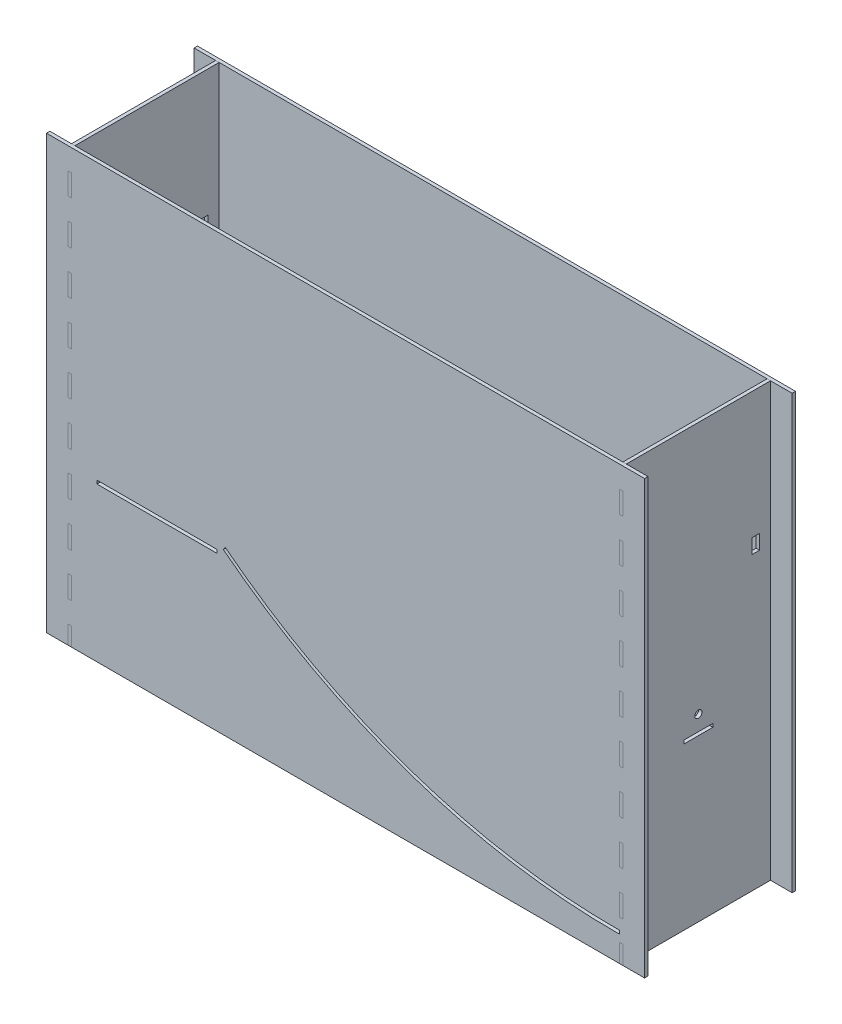
from build123d import *

# Parameters (mm, degrees)
SKETCH1_W                  = 488.5944
SKETCH1_H                  = 132.9944
SKETCH1_W_2                = 482.6
SKETCH1_H_2                = 127
BASE_EXTRUDE_DEPTH         = 2.9972
SKETCH1_3_W                = 488.5944
SKETCH1_3_H                = 132.9944
SKETCH1_3_W_2              = 482.6
SKETCH1_3_H_2              = 127
WALL_EXTRUDE_DEPTH         = 383.9972
LEDGERAMP_W                = 105.8672
LEDGERAMP_H                = 2.9972
CUT_EXTRUDE6_DEPTH         = 475.154491666
SKETCH19_R                 = 3.175
SKETCH19_W                 = 25.4
SKETCH19_H                 = 2.9972
SKETCH19_W_2               = 6.477
SKETCH19_H_2               = 12.827
SIDE_CUTS_DEPTH            = 625.980171627
SKETCH23_W                 = 19.05
SKETCH23_H                 = 383.9972
BOSS_EXTRUDE1_DEPTH        = 2.9972
BOSS_EXTRUDE2_START        = -132.9944
SKETCH23_2_W               = 19.05
SKETCH23_2_H               = 383.9972
BOSS_EXTRUDE2_DEPTH        = 2.9972
SKETCH21_W                 = 12.827
SKETCH21_H                 = 6.477
SKETCH21_W_2               = 6.477
SKETCH21_H_2               = 12.827
SKETCH21_W_3               = 3.175
BOTTOM_SUPPORT_HOLES_DEPTH = 471.348248603
SPLIT1_START               = -244.2972
SPLIT1_OUTLINE_W           = 12.827
SPLIT1_OUTLINE_H           = 6.477
SPLIT1_OUTLINE_W_2         = 2.9972
SPLIT1_OUTLINE_H_2         = 25.4
SPLIT1_OUTLINE_R           = 3.175
SPLIT1_DEPTH               = 2.9972
SPLIT1_START_2             = 2.9972
SPLIT1_2_OUTLINE_W         = 2.9972
SPLIT1_2_OUTLINE_H         = 127
SPLIT1_2_DEPTH             = 381
SPLIT1_3_OUTLINE_W         = 2.9972
SPLIT1_3_OUTLINE_H         = 12.0904
SPLIT1_3_DEPTH             = 19.19986
SPLIT1_START_3             = 38.39972
SPLIT1_4_OUTLINE_W         = 2.9972
SPLIT1_4_OUTLINE_H         = 2.9972
SPLIT1_4_DEPTH             = 19.19986
SPLIT1_START_4             = 76.79944
SPLIT1_5_OUTLINE_W         = 2.9972
SPLIT1_5_OUTLINE_H         = 2.9972
SPLIT1_5_DEPTH             = 19.19986
SPLIT1_START_5             = 115.19916
SPLIT1_6_OUTLINE_W         = 2.9972
SPLIT1_6_OUTLINE_H         = 2.9972
SPLIT1_6_DEPTH             = 19.19986
SPLIT1_START_6             = 153.59888
SPLIT1_7_OUTLINE_W         = 2.9972
SPLIT1_7_OUTLINE_H         = 2.9972
SPLIT1_7_DEPTH             = 19.19986
SPLIT1_START_7             = 191.9986
SPLIT1_8_OUTLINE_W         = 2.9972
SPLIT1_8_OUTLINE_H         = 2.9972
SPLIT1_8_DEPTH             = 19.19986
SPLIT1_START_8             = 230.39832
SPLIT1_9_OUTLINE_W         = 2.9972
SPLIT1_9_OUTLINE_H         = 2.9972
SPLIT1_9_DEPTH             = 19.19986
SPLIT1_START_9             = 268.79804
SPLIT1_10_OUTLINE_W        = 2.9972
SPLIT1_10_OUTLINE_H        = 2.9972
SPLIT1_10_DEPTH            = 19.19986
SPLIT1_START_10            = 307.19776
SPLIT1_11_OUTLINE_W        = 2.9972
SPLIT1_11_OUTLINE_H        = 2.9972
SPLIT1_11_DEPTH            = 19.19986
SPLIT1_START_11            = 345.59748
SPLIT1_12_OUTLINE_W        = 2.9972
SPLIT1_12_OUTLINE_H        = 2.9972
SPLIT1_12_DEPTH            = 19.19986
SPLIT2_START               = 241.3
SPLIT2_OUTLINE_W           = 12.827
SPLIT2_OUTLINE_H           = 6.477
SPLIT2_OUTLINE_W_2         = 2.9972
SPLIT2_OUTLINE_H_2         = 25.4
SPLIT2_OUTLINE_R           = 3.175
SPLIT2_DEPTH               = 2.9972
SPLIT2_START_2             = 2.9972
SPLIT2_2_OUTLINE_W         = 2.9972
SPLIT2_2_OUTLINE_H         = 127
SPLIT2_2_DEPTH             = 381
SPLIT2_3_OUTLINE_W         = 2.9972
SPLIT2_3_OUTLINE_H         = 12.0904
SPLIT2_3_DEPTH             = 19.19986
SPLIT2_START_3             = 38.39972
SPLIT2_4_OUTLINE_W         = 2.9972
SPLIT2_4_OUTLINE_H         = 2.9972
SPLIT2_4_DEPTH             = 19.19986
SPLIT2_START_4             = 76.79944
SPLIT2_5_OUTLINE_W         = 2.9972
SPLIT2_5_OUTLINE_H         = 2.9972
SPLIT2_5_DEPTH             = 19.19986
SPLIT2_START_5             = 115.19916
SPLIT2_6_OUTLINE_W         = 2.9972
SPLIT2_6_OUTLINE_H         = 2.9972
SPLIT2_6_DEPTH             = 19.19986
SPLIT2_START_6             = 153.59888
SPLIT2_7_OUTLINE_W         = 2.9972
SPLIT2_7_OUTLINE_H         = 2.9972
SPLIT2_7_DEPTH             = 19.19986
SPLIT2_START_7             = 191.9986
SPLIT2_8_OUTLINE_W         = 2.9972
SPLIT2_8_OUTLINE_H         = 2.9972
SPLIT2_8_DEPTH             = 19.19986
SPLIT2_START_8             = 230.39832
SPLIT2_9_OUTLINE_W         = 2.9972
SPLIT2_9_OUTLINE_H         = 2.9972
SPLIT2_9_DEPTH             = 19.19986
SPLIT2_START_9             = 268.79804
SPLIT2_10_OUTLINE_W        = 2.9972
SPLIT2_10_OUTLINE_H        = 2.9972
SPLIT2_10_DEPTH            = 19.19986
SPLIT2_START_10            = 307.19776
SPLIT2_11_OUTLINE_W        = 2.9972
SPLIT2_11_OUTLINE_H        = 2.9972
SPLIT2_11_DEPTH            = 19.19986
SPLIT2_START_11            = 345.59748
SPLIT2_12_OUTLINE_W        = 2.9972
SPLIT2_12_OUTLINE_H        = 2.9972
SPLIT2_12_DEPTH            = 19.19986
SKETCH22_W                 = 526.6944
SKETCH22_H                 = 2.9972
CUT_EXTRUDE5_DEPTH         = 485.24488411


# Read off the part's stored shape, not the designer's step: Split1, Split2
with BuildPart() as part:
    # Sketch1 → Base Extrude (new body)
    # profile 1 of 2: a face of its own
    with BuildSketch(Plane(origin=(0, 0, 0), x_dir=(1, 0, 0), z_dir=(0, 1, 0))):
        Rectangle(SKETCH1_W, SKETCH1_H)
        Rectangle(SKETCH1_W_2, SKETCH1_H_2, mode=Mode.SUBTRACT)
    # profile 2 of 2: a face of its own
    with BuildSketch(Plane(origin=(0, 0, 0), x_dir=(1, 0, 0), z_dir=(0, 1, 0))):
        Rectangle(SKETCH1_W_2, SKETCH1_H_2)
    extrude(amount=BASE_EXTRUDE_DEPTH)

    # Sketch1<3> → Wall Extrude (add)
    with BuildSketch(Plane(origin=(0, 0, 0), x_dir=(1, 0, 0), z_dir=(0, 1, 0))):
        Rectangle(SKETCH1_3_W, SKETCH1_3_H)
        Rectangle(SKETCH1_3_W_2, SKETCH1_3_H_2, mode=Mode.SUBTRACT)
    extrude(amount=WALL_EXTRUDE_DEPTH)

    # LedgeRamp → Cut-Extrude6 (cut, through all)
    with BuildSketch(Plane.XY.offset(66.4972)):
        with Locations((-165.9636, 140.125825062)):
            Rectangle(LEDGERAMP_W, LEDGERAMP_H)
        with BuildLine():
            Line((-107.653518998, 144.347145989), (-105.808258425, 146.70897182))
            ThreePointArc((-105.808258425, 146.70897182), (57.751905861, 58.232368422), (241.3, 28.397257769))
            Line((241.3, 28.397257769), (241.3, 25.4))
            ThreePointArc((241.3, 25.4), (56.776108201, 55.39844652), (-107.653518998, 144.347145989))
        make_face()
    extrude(amount=-CUT_EXTRUDE6_DEPTH, mode=Mode.SUBTRACT)

    # Sketch19 → Side Cuts (cut, through all)
    with BuildSketch(Plane.ZY.offset(244.2972)):
        with Locations((0, 161.511017861)):
            Circle(SKETCH19_R)
        with Locations((0, 146.550417861)):
            Rectangle(SKETCH19_W, SKETCH19_H)
        with Locations((-50.5587, 266.02310893)):
            Rectangle(SKETCH19_W_2, SKETCH19_H_2)
        with Locations((50.5587, 266.02310893)):
            Rectangle(SKETCH19_W_2, SKETCH19_H_2)
    extrude(amount=-SIDE_CUTS_DEPTH, mode=Mode.SUBTRACT)

    # Sketch23 → Boss-Extrude1 (add)
    with BuildSketch(Plane.XY.offset(66.4972)):
        with Locations((-253.8222, 191.9986)):
            Rectangle(SKETCH23_W, SKETCH23_H)
        with Locations((253.8222, 191.9986)):
            Rectangle(SKETCH23_W, SKETCH23_H)
    extrude(amount=-BOSS_EXTRUDE1_DEPTH)

    # Sketch23<2> → Boss-Extrude2 (add)
    with BuildSketch(Plane.XY.offset(66.4972).offset(BOSS_EXTRUDE2_START)):
        with Locations((-253.8222, 191.9986)):
            Rectangle(SKETCH23_2_W, SKETCH23_2_H)
        with Locations((253.8222, 191.9986)):
            Rectangle(SKETCH23_2_W, SKETCH23_2_H)
    extrude(amount=BOSS_EXTRUDE2_DEPTH)

    # Sketch21 → Bottom Support Holes (cut, through all)
    with BuildSketch(Plane.XZ):
        with Locations((0, 50.5587)):
            Rectangle(SKETCH21_W, SKETCH21_H)
        with Locations((-228.3587, 0)):
            Rectangle(SKETCH21_W_2, SKETCH21_H_2)
        with Locations((0, -50.5587)):
            Rectangle(SKETCH21_W, SKETCH21_H)
        with Locations((230.0097, 0)):
            Rectangle(SKETCH21_W_3, SKETCH21_H_2)
    extrude(amount=-BOTTOM_SUPPORT_HOLES_DEPTH, mode=Mode.SUBTRACT)

    # Split1 2 outline → Split1 2 (cut)
    with BuildSketch(Plane(origin=(0, 0, 0), x_dir=(1, 0, 0), z_dir=(0, 1, 0)).offset(SPLIT1_START_2)):
        with Locations((-242.7986, 0)):
            Rectangle(SPLIT1_2_OUTLINE_W, SPLIT1_2_OUTLINE_H)
    extrude(amount=SPLIT1_2_DEPTH, mode=Mode.SUBTRACT)

    # Split1 3 outline → Split1 3 (cut)
    with BuildSketch(Plane(origin=(0, 0, 0), x_dir=(1, 0, 0), z_dir=(0, 1, 0))):
        with Locations((-242.7986, 60.452)):
            Rectangle(SPLIT1_3_OUTLINE_W, SPLIT1_3_OUTLINE_H)
        with Locations((-242.7986, 36.2712)):
            Rectangle(SPLIT1_3_OUTLINE_W, SPLIT1_3_OUTLINE_H)
        with Locations((-242.7986, 12.0904)):
            Rectangle(SPLIT1_3_OUTLINE_W, SPLIT1_3_OUTLINE_H)
        with Locations((-242.7986, -12.0904)):
            Rectangle(SPLIT1_3_OUTLINE_W, SPLIT1_3_OUTLINE_H)
        with Locations((-242.7986, -36.2712)):
            Rectangle(SPLIT1_3_OUTLINE_W, SPLIT1_3_OUTLINE_H)
        with Locations((-242.7986, -60.452)):
            Rectangle(SPLIT1_3_OUTLINE_W, SPLIT1_3_OUTLINE_H)
    extrude(amount=SPLIT1_3_DEPTH, mode=Mode.SUBTRACT)

    # Split1 4 outline → Split1 4 (cut)
    with BuildSketch(Plane(origin=(0, 0, 0), x_dir=(1, 0, 0), z_dir=(0, 1, 0)).offset(SPLIT1_START_3)):
        with Locations((-242.7986, 64.9986)):
            Rectangle(SPLIT1_4_OUTLINE_W, SPLIT1_4_OUTLINE_H)
        with Locations((-242.7986, -64.9986)):
            Rectangle(SPLIT1_4_OUTLINE_W, SPLIT1_4_OUTLINE_H)
    extrude(amount=SPLIT1_4_DEPTH, mode=Mode.SUBTRACT)

    # Split1 5 outline → Split1 5 (cut)
    with BuildSketch(Plane(origin=(0, 0, 0), x_dir=(1, 0, 0), z_dir=(0, 1, 0)).offset(SPLIT1_START_4)):
        with Locations((-242.7986, 64.9986)):
            Rectangle(SPLIT1_5_OUTLINE_W, SPLIT1_5_OUTLINE_H)
        with Locations((-242.7986, -64.9986)):
            Rectangle(SPLIT1_5_OUTLINE_W, SPLIT1_5_OUTLINE_H)
    extrude(amount=SPLIT1_5_DEPTH, mode=Mode.SUBTRACT)

    # Split1 6 outline → Split1 6 (cut)
    with BuildSketch(Plane(origin=(0, 0, 0), x_dir=(1, 0, 0), z_dir=(0, 1, 0)).offset(SPLIT1_START_5)):
        with Locations((-242.7986, 64.9986)):
            Rectangle(SPLIT1_6_OUTLINE_W, SPLIT1_6_OUTLINE_H)
        with Locations((-242.7986, -64.9986)):
            Rectangle(SPLIT1_6_OUTLINE_W, SPLIT1_6_OUTLINE_H)
    extrude(amount=SPLIT1_6_DEPTH, mode=Mode.SUBTRACT)

    # Split1 7 outline → Split1 7 (cut)
    with BuildSketch(Plane(origin=(0, 0, 0), x_dir=(1, 0, 0), z_dir=(0, 1, 0)).offset(SPLIT1_START_6)):
        with Locations((-242.7986, 64.9986)):
            Rectangle(SPLIT1_7_OUTLINE_W, SPLIT1_7_OUTLINE_H)
        with Locations((-242.7986, -64.9986)):
            Rectangle(SPLIT1_7_OUTLINE_W, SPLIT1_7_OUTLINE_H)
    extrude(amount=SPLIT1_7_DEPTH, mode=Mode.SUBTRACT)

    # Split1 8 outline → Split1 8 (cut)
    with BuildSketch(Plane(origin=(0, 0, 0), x_dir=(1, 0, 0), z_dir=(0, 1, 0)).offset(SPLIT1_START_7)):
        with Locations((-242.7986, 64.9986)):
            Rectangle(SPLIT1_8_OUTLINE_W, SPLIT1_8_OUTLINE_H)
        with Locations((-242.7986, -64.9986)):
            Rectangle(SPLIT1_8_OUTLINE_W, SPLIT1_8_OUTLINE_H)
    extrude(amount=SPLIT1_8_DEPTH, mode=Mode.SUBTRACT)

    # Split1 9 outline → Split1 9 (cut)
    with BuildSketch(Plane(origin=(0, 0, 0), x_dir=(1, 0, 0), z_dir=(0, 1, 0)).offset(SPLIT1_START_8)):
        with Locations((-242.7986, 64.9986)):
            Rectangle(SPLIT1_9_OUTLINE_W, SPLIT1_9_OUTLINE_H)
        with Locations((-242.7986, -64.9986)):
            Rectangle(SPLIT1_9_OUTLINE_W, SPLIT1_9_OUTLINE_H)
    extrude(amount=SPLIT1_9_DEPTH, mode=Mode.SUBTRACT)

    # Split1 10 outline → Split1 10 (cut)
    with BuildSketch(Plane(origin=(0, 0, 0), x_dir=(1, 0, 0), z_dir=(0, 1, 0)).offset(SPLIT1_START_9)):
        with Locations((-242.7986, 64.9986)):
            Rectangle(SPLIT1_10_OUTLINE_W, SPLIT1_10_OUTLINE_H)
        with Locations((-242.7986, -64.9986)):
            Rectangle(SPLIT1_10_OUTLINE_W, SPLIT1_10_OUTLINE_H)
    extrude(amount=SPLIT1_10_DEPTH, mode=Mode.SUBTRACT)

    # Split1 11 outline → Split1 11 (cut)
    with BuildSketch(Plane(origin=(0, 0, 0), x_dir=(1, 0, 0), z_dir=(0, 1, 0)).offset(SPLIT1_START_10)):
        with Locations((-242.7986, 64.9986)):
            Rectangle(SPLIT1_11_OUTLINE_W, SPLIT1_11_OUTLINE_H)
        with Locations((-242.7986, -64.9986)):
            Rectangle(SPLIT1_11_OUTLINE_W, SPLIT1_11_OUTLINE_H)
    extrude(amount=SPLIT1_11_DEPTH, mode=Mode.SUBTRACT)

    # Split1 12 outline → Split1 12 (cut)
    with BuildSketch(Plane(origin=(0, 0, 0), x_dir=(1, 0, 0), z_dir=(0, 1, 0)).offset(SPLIT1_START_11)):
        with Locations((-242.7986, 64.9986)):
            Rectangle(SPLIT1_12_OUTLINE_W, SPLIT1_12_OUTLINE_H)
        with Locations((-242.7986, -64.9986)):
            Rectangle(SPLIT1_12_OUTLINE_W, SPLIT1_12_OUTLINE_H)
    extrude(amount=SPLIT1_12_DEPTH, mode=Mode.SUBTRACT)

    # Split2 2 outline → Split2 2 (cut)
    with BuildSketch(Plane(origin=(0, 0, 0), x_dir=(1, 0, 0), z_dir=(0, 1, 0)).offset(SPLIT2_START_2)):
        with Locations((242.7986, 0)):
            Rectangle(SPLIT2_2_OUTLINE_W, SPLIT2_2_OUTLINE_H)
    extrude(amount=SPLIT2_2_DEPTH, mode=Mode.SUBTRACT)

    # Split2 3 outline → Split2 3 (cut)
    with BuildSketch(Plane(origin=(0, 0, 0), x_dir=(1, 0, 0), z_dir=(0, 1, 0))):
        with Locations((242.7986, 60.452)):
            Rectangle(SPLIT2_3_OUTLINE_W, SPLIT2_3_OUTLINE_H)
        with Locations((242.7986, 36.2712)):
            Rectangle(SPLIT2_3_OUTLINE_W, SPLIT2_3_OUTLINE_H)
        with Locations((242.7986, 12.0904)):
            Rectangle(SPLIT2_3_OUTLINE_W, SPLIT2_3_OUTLINE_H)
        with Locations((242.7986, -12.0904)):
            Rectangle(SPLIT2_3_OUTLINE_W, SPLIT2_3_OUTLINE_H)
        with Locations((242.7986, -36.2712)):
            Rectangle(SPLIT2_3_OUTLINE_W, SPLIT2_3_OUTLINE_H)
        with Locations((242.7986, -60.452)):
            Rectangle(SPLIT2_3_OUTLINE_W, SPLIT2_3_OUTLINE_H)
    extrude(amount=SPLIT2_3_DEPTH, mode=Mode.SUBTRACT)

    # Split2 4 outline → Split2 4 (cut)
    with BuildSketch(Plane(origin=(0, 0, 0), x_dir=(1, 0, 0), z_dir=(0, 1, 0)).offset(SPLIT2_START_3)):
        with Locations((242.7986, 64.9986)):
            Rectangle(SPLIT2_4_OUTLINE_W, SPLIT2_4_OUTLINE_H)
        with Locations((242.7986, -64.9986)):
            Rectangle(SPLIT2_4_OUTLINE_W, SPLIT2_4_OUTLINE_H)
    extrude(amount=SPLIT2_4_DEPTH, mode=Mode.SUBTRACT)

    # Split2 5 outline → Split2 5 (cut)
    with BuildSketch(Plane(origin=(0, 0, 0), x_dir=(1, 0, 0), z_dir=(0, 1, 0)).offset(SPLIT2_START_4)):
        with Locations((242.7986, 64.9986)):
            Rectangle(SPLIT2_5_OUTLINE_W, SPLIT2_5_OUTLINE_H)
        with Locations((242.7986, -64.9986)):
            Rectangle(SPLIT2_5_OUTLINE_W, SPLIT2_5_OUTLINE_H)
    extrude(amount=SPLIT2_5_DEPTH, mode=Mode.SUBTRACT)

    # Split2 6 outline → Split2 6 (cut)
    with BuildSketch(Plane(origin=(0, 0, 0), x_dir=(1, 0, 0), z_dir=(0, 1, 0)).offset(SPLIT2_START_5)):
        with Locations((242.7986, 64.9986)):
            Rectangle(SPLIT2_6_OUTLINE_W, SPLIT2_6_OUTLINE_H)
        with Locations((242.7986, -64.9986)):
            Rectangle(SPLIT2_6_OUTLINE_W, SPLIT2_6_OUTLINE_H)
    extrude(amount=SPLIT2_6_DEPTH, mode=Mode.SUBTRACT)

    # Split2 7 outline → Split2 7 (cut)
    with BuildSketch(Plane(origin=(0, 0, 0), x_dir=(1, 0, 0), z_dir=(0, 1, 0)).offset(SPLIT2_START_6)):
        with Locations((242.7986, 64.9986)):
            Rectangle(SPLIT2_7_OUTLINE_W, SPLIT2_7_OUTLINE_H)
        with Locations((242.7986, -64.9986)):
            Rectangle(SPLIT2_7_OUTLINE_W, SPLIT2_7_OUTLINE_H)
    extrude(amount=SPLIT2_7_DEPTH, mode=Mode.SUBTRACT)

    # Split2 8 outline → Split2 8 (cut)
    with BuildSketch(Plane(origin=(0, 0, 0), x_dir=(1, 0, 0), z_dir=(0, 1, 0)).offset(SPLIT2_START_7)):
        with Locations((242.7986, 64.9986)):
            Rectangle(SPLIT2_8_OUTLINE_W, SPLIT2_8_OUTLINE_H)
        with Locations((242.7986, -64.9986)):
            Rectangle(SPLIT2_8_OUTLINE_W, SPLIT2_8_OUTLINE_H)
    extrude(amount=SPLIT2_8_DEPTH, mode=Mode.SUBTRACT)

    # Split2 9 outline → Split2 9 (cut)
    with BuildSketch(Plane(origin=(0, 0, 0), x_dir=(1, 0, 0), z_dir=(0, 1, 0)).offset(SPLIT2_START_8)):
        with Locations((242.7986, 64.9986)):
            Rectangle(SPLIT2_9_OUTLINE_W, SPLIT2_9_OUTLINE_H)
        with Locations((242.7986, -64.9986)):
            Rectangle(SPLIT2_9_OUTLINE_W, SPLIT2_9_OUTLINE_H)
    extrude(amount=SPLIT2_9_DEPTH, mode=Mode.SUBTRACT)

    # Split2 10 outline → Split2 10 (cut)
    with BuildSketch(Plane(origin=(0, 0, 0), x_dir=(1, 0, 0), z_dir=(0, 1, 0)).offset(SPLIT2_START_9)):
        with Locations((242.7986, 64.9986)):
            Rectangle(SPLIT2_10_OUTLINE_W, SPLIT2_10_OUTLINE_H)
        with Locations((242.7986, -64.9986)):
            Rectangle(SPLIT2_10_OUTLINE_W, SPLIT2_10_OUTLINE_H)
    extrude(amount=SPLIT2_10_DEPTH, mode=Mode.SUBTRACT)

    # Split2 11 outline → Split2 11 (cut)
    with BuildSketch(Plane(origin=(0, 0, 0), x_dir=(1, 0, 0), z_dir=(0, 1, 0)).offset(SPLIT2_START_10)):
        with Locations((242.7986, 64.9986)):
            Rectangle(SPLIT2_11_OUTLINE_W, SPLIT2_11_OUTLINE_H)
        with Locations((242.7986, -64.9986)):
            Rectangle(SPLIT2_11_OUTLINE_W, SPLIT2_11_OUTLINE_H)
    extrude(amount=SPLIT2_11_DEPTH, mode=Mode.SUBTRACT)

    # Split2 12 outline → Split2 12 (cut)
    with BuildSketch(Plane(origin=(0, 0, 0), x_dir=(1, 0, 0), z_dir=(0, 1, 0)).offset(SPLIT2_START_11)):
        with Locations((242.7986, 64.9986)):
            Rectangle(SPLIT2_12_OUTLINE_W, SPLIT2_12_OUTLINE_H)
        with Locations((242.7986, -64.9986)):
            Rectangle(SPLIT2_12_OUTLINE_W, SPLIT2_12_OUTLINE_H)
    extrude(amount=SPLIT2_12_DEPTH, mode=Mode.SUBTRACT)


with BuildPart() as body_2:
    # Split1 outline → Split1 (new body)
    with BuildSketch(Plane.YZ.offset(SPLIT1_START)):
        Polygon((38.39972, 63.5), (19.19986, 63.5), (19.19986, 66.4972), (0, 66.4972), (0, 54.4068), (2.9972, 54.4068), (2.9972, 42.3164), (0, 42.3164), (0, 30.226), (2.9972, 30.226), (2.9972, 18.1356), (0, 18.1356), (0, 6.0452), (2.9972, 6.0452), (2.9972, -6.0452), (0, -6.0452), (0, -18.1356), (2.9972, -18.1356), (2.9972, -30.226), (0, -30.226), (0, -42.3164), (2.9972, -42.3164), (2.9972, -54.4068), (0, -54.4068), (0, -66.4972), (19.19986, -66.4972), (19.19986, -63.5), (38.39972, -63.5), (38.39972, -66.4972), (57.59958, -66.4972), (57.59958, -63.5), (76.79944, -63.5), (76.79944, -66.4972), (95.9993, -66.4972), (95.9993, -63.5), (115.19916, -63.5), (115.19916, -66.4972), (134.39902, -66.4972), (134.39902, -63.5), (153.59888, -63.5), (153.59888, -66.4972), (172.79874, -66.4972), (172.79874, -63.5), (191.9986, -63.5), (191.9986, -66.4972), (211.19846, -66.4972), (211.19846, -63.5), (230.39832, -63.5), (230.39832, -66.4972), (249.59818, -66.4972), (249.59818, -63.5), (268.79804, -63.5), (268.79804, -66.4972), (287.9979, -66.4972), (287.9979, -63.5), (307.19776, -63.5), (307.19776, -66.4972), (326.39762, -66.4972), (326.39762, -63.5), (345.59748, -63.5), (345.59748, -66.4972), (364.79734, -66.4972), (364.79734, -63.5), (383.9972, -63.5), (383.9972, 63.5), (364.79734, 63.5), (364.79734, 66.4972), (345.59748, 66.4972), (345.59748, 63.5), (326.39762, 63.5), (326.39762, 66.4972), (307.19776, 66.4972), (307.19776, 63.5), (287.9979, 63.5), (287.9979, 66.4972), (268.79804, 66.4972), (268.79804, 63.5), (249.59818, 63.5), (249.59818, 66.4972), (230.39832, 66.4972), (230.39832, 63.5), (211.19846, 63.5), (211.19846, 66.4972), (191.9986, 66.4972), (191.9986, 63.5), (172.79874, 63.5), (172.79874, 66.4972), (153.59888, 66.4972), (153.59888, 63.5), (134.39902, 63.5), (134.39902, 66.4972), (115.19916, 66.4972), (115.19916, 63.5), (95.9993, 63.5), (95.9993, 66.4972), (76.79944, 66.4972), (76.79944, 63.5), (57.59958, 63.5), (57.59958, 66.4972), (38.39972, 66.4972), align=None)
        with Locations((266.02310893, -50.5587)):
            Rectangle(SPLIT1_OUTLINE_W, SPLIT1_OUTLINE_H, mode=Mode.SUBTRACT)
        with Locations((146.550417861, 0)):
            Rectangle(SPLIT1_OUTLINE_W_2, SPLIT1_OUTLINE_H_2, mode=Mode.SUBTRACT)
        with Locations((161.511017861, 0)):
            Circle(SPLIT1_OUTLINE_R, mode=Mode.SUBTRACT)
        with Locations((266.02310893, 50.5587)):
            Rectangle(SPLIT1_OUTLINE_W, SPLIT1_OUTLINE_H, mode=Mode.SUBTRACT)
    extrude(amount=SPLIT1_DEPTH)


with BuildPart() as body_3:
    # Split2 outline → Split2 (new body)
    with BuildSketch(Plane.YZ.offset(SPLIT2_START)):
        Polygon((383.9972, 63.5), (364.79734, 63.5), (364.79734, 66.4972), (345.59748, 66.4972), (345.59748, 63.5), (326.39762, 63.5), (326.39762, 66.4972), (307.19776, 66.4972), (307.19776, 63.5), (287.9979, 63.5), (287.9979, 66.4972), (268.79804, 66.4972), (268.79804, 63.5), (249.59818, 63.5), (249.59818, 66.4972), (230.39832, 66.4972), (230.39832, 63.5), (211.19846, 63.5), (211.19846, 66.4972), (191.9986, 66.4972), (191.9986, 63.5), (172.79874, 63.5), (172.79874, 66.4972), (153.59888, 66.4972), (153.59888, 63.5), (134.39902, 63.5), (134.39902, 66.4972), (115.19916, 66.4972), (115.19916, 63.5), (95.9993, 63.5), (95.9993, 66.4972), (76.79944, 66.4972), (76.79944, 63.5), (57.59958, 63.5), (57.59958, 66.4972), (38.39972, 66.4972), (38.39972, 63.5), (19.19986, 63.5), (19.19986, 66.4972), (0, 66.4972), (0, 54.4068), (2.9972, 54.4068), (2.9972, 42.3164), (0, 42.3164), (0, 30.226), (2.9972, 30.226), (2.9972, 18.1356), (0, 18.1356), (0, 6.0452), (2.9972, 6.0452), (2.9972, -6.0452), (0, -6.0452), (0, -18.1356), (2.9972, -18.1356), (2.9972, -30.226), (0, -30.226), (0, -42.3164), (2.9972, -42.3164), (2.9972, -54.4068), (0, -54.4068), (0, -66.4972), (19.19986, -66.4972), (19.19986, -63.5), (38.39972, -63.5), (38.39972, -66.4972), (57.59958, -66.4972), (57.59958, -63.5), (76.79944, -63.5), (76.79944, -66.4972), (95.9993, -66.4972), (95.9993, -63.5), (115.19916, -63.5), (115.19916, -66.4972), (134.39902, -66.4972), (134.39902, -63.5), (153.59888, -63.5), (153.59888, -66.4972), (172.79874, -66.4972), (172.79874, -63.5), (191.9986, -63.5), (191.9986, -66.4972), (211.19846, -66.4972), (211.19846, -63.5), (230.39832, -63.5), (230.39832, -66.4972), (249.59818, -66.4972), (249.59818, -63.5), (268.79804, -63.5), (268.79804, -66.4972), (287.9979, -66.4972), (287.9979, -63.5), (307.19776, -63.5), (307.19776, -66.4972), (326.39762, -66.4972), (326.39762, -63.5), (345.59748, -63.5), (345.59748, -66.4972), (364.79734, -66.4972), (364.79734, -63.5), (383.9972, -63.5), align=None)
        with Locations((266.02310893, -50.5587)):
            Rectangle(SPLIT2_OUTLINE_W, SPLIT2_OUTLINE_H, mode=Mode.SUBTRACT)
        with Locations((146.550417861, 0)):
            Rectangle(SPLIT2_OUTLINE_W_2, SPLIT2_OUTLINE_H_2, mode=Mode.SUBTRACT)
        with Locations((161.511017861, 0)):
            Circle(SPLIT2_OUTLINE_R, mode=Mode.SUBTRACT)
        with Locations((266.02310893, 50.5587)):
            Rectangle(SPLIT2_OUTLINE_W, SPLIT2_OUTLINE_H, mode=Mode.SUBTRACT)
    extrude(amount=SPLIT2_DEPTH)


with BuildPart() as cut_extrude5_tool:
    # Sketch22 → Cut-Extrude5 (new, through all)
    with BuildSketch(Plane.XY.offset(66.4972)):
        with Locations((0, 1.4986)):
            Rectangle(SKETCH22_W, SKETCH22_H)
    extrude(amount=-CUT_EXTRUDE5_DEPTH)


with BuildPart() as part_1:
    add(part.part)

    # Cut-Extrude5: cut by cut_extrude5_tool
    add(cut_extrude5_tool.part, mode=Mode.SUBTRACT)


with BuildPart() as body_2_1:
    add(body_2.part)

    # Cut-Extrude5: cut by cut_extrude5_tool
    add(cut_extrude5_tool.part, mode=Mode.SUBTRACT)


with BuildPart() as body_3_1:
    add(body_3.part)

    # Cut-Extrude5: cut by cut_extrude5_tool
    add(cut_extrude5_tool.part, mode=Mode.SUBTRACT)


solid = Compound([part_1.part, body_2_1.part, body_3_1.part])
